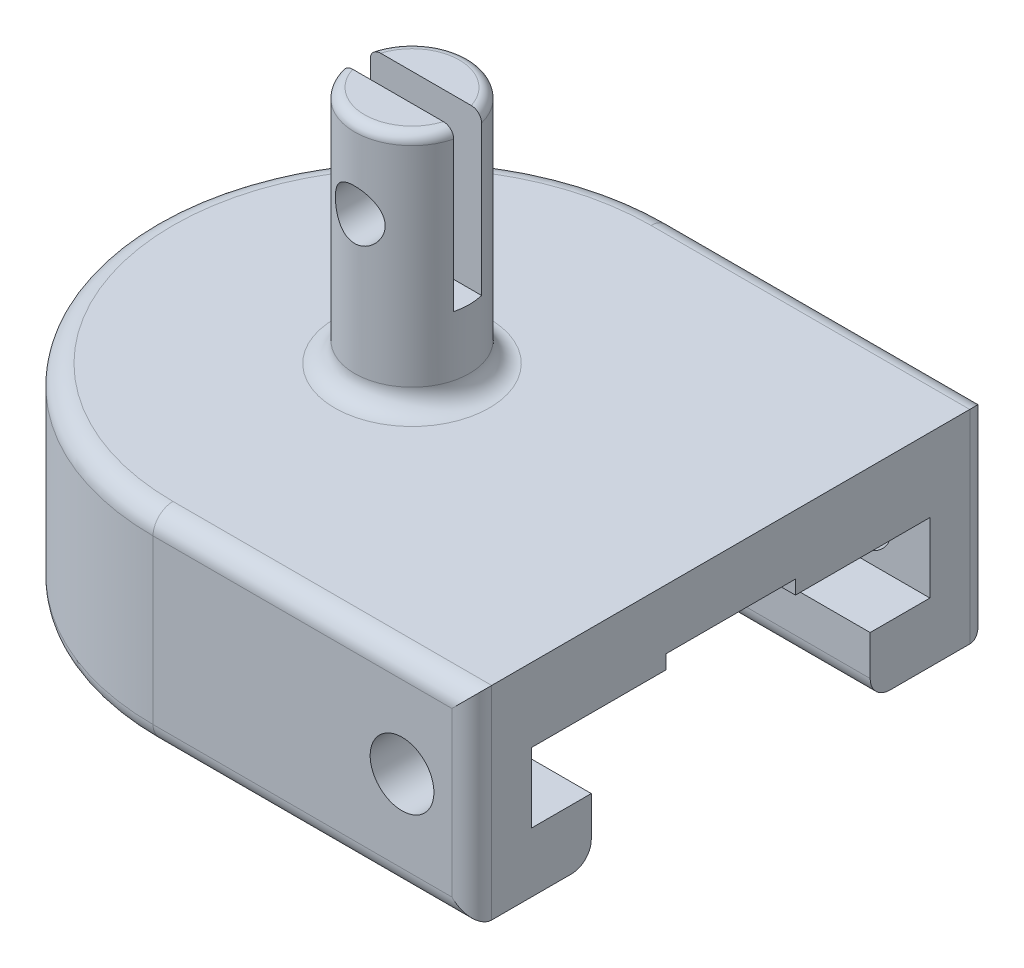
from build123d import *

# Parameters (mm, degrees)
BOSS_EXTRUDE1_DEPTH   = 3
BOSS_EXTRUDE2_DEPTH   = 3.5
BOSS_EXTRUDE3_DEPTH   = 3.7
SKETCH4_R             = 2.88
BOSS_EXTRUDE4_DEPTH   = 12
SKETCH11_W            = 6.5
SKETCH11_H            = 0.7
CUT_EXTRUDE3_DEPTH    = 23
F_2_5MM_DOWEL_HOLE1_D = 2.5
SKETCH8_R             = 1.6
CUT_EXTRUDE1_DEPTH    = 38.747052924
FILLET1_R             = 1
FILLET2_R             = 1
CUT_EXTRUDE2_START    = -8
CUT_EXTRUDE2_DEPTH    = 8
FILLET3_R             = 0.5


with BuildPart() as part:
    # Sketch1 → Boss-Extrude1 (new body)
    with BuildSketch(Plane(origin=(0, 0, 0), x_dir=(1, 0, 0), z_dir=(0, 1, 0))):
        with BuildLine():
            Line((0, 13), (16, 13))
            Line((16, 13), (16, 7))
            Line((16, 7), (0, 7))
            ThreePointArc((0, 7), (-7, 0), (0, -7))
            Line((0, -7), (16, -7))
            Line((16, -7), (16, -13))
            Line((16, -13), (0, -13))
            ThreePointArc((0, -13), (-13, 0), (0, 13))
        make_face()
    extrude(amount=BOSS_EXTRUDE1_DEPTH)

    # Sketch2 → Boss-Extrude2 (add)
    with BuildSketch(Plane(origin=(0, 3, 0), x_dir=(1, 0, 0), z_dir=(0, 1, 0))):
        with BuildLine():
            Line((0, 13), (16, 13))
            Line((16, 13), (16, 10))
            Line((16, 10), (0, 10))
            ThreePointArc((0, 10), (-10, 0), (0, -10))
            Line((0, -10), (16, -10))
            Line((16, -10), (16, -13))
            Line((16, -13), (0, -13))
            ThreePointArc((0, -13), (-13, 0), (0, 13))
        make_face()
    extrude(amount=BOSS_EXTRUDE2_DEPTH)

    # Sketch3 → Boss-Extrude3 (add)
    with BuildSketch(Plane(origin=(0, 6.5, 0), x_dir=(1, 0, 0), z_dir=(0, 1, 0))):
        with BuildLine():
            Line((16, 13), (0, 13))
            ThreePointArc((0, 13), (-13, 0), (0, -13))
            Line((0, -13), (16, -13))
            Line((16, -13), (16, -7))
            Line((16, -7), (16, 7))
            Line((16, 7), (16, 13))
        make_face()
    extrude(amount=BOSS_EXTRUDE3_DEPTH)

    # Sketch4 → Boss-Extrude4 (add)
    with BuildSketch(Plane(origin=(0, 10.2, 0), x_dir=(1, 0, 0), z_dir=(0, 1, 0))):
        Circle(SKETCH4_R)
    extrude(amount=BOSS_EXTRUDE4_DEPTH)

    # Sketch11 → Cut-Extrude3 (cut)
    with BuildSketch(Plane(origin=(16, 0, 0), x_dir=(0, 0, -1), z_dir=(1, 0, 0))):
        with Locations((0, 6.85)):
            Rectangle(SKETCH11_W, SKETCH11_H)
    extrude(amount=-CUT_EXTRUDE3_DEPTH, mode=Mode.SUBTRACT)

    # Ø2.5mm Dowel Hole1 (through all)
    with Locations(Plane(origin=(-0.002429038, 18.104937254, 2.879998976), x_dir=(0.999999644325, 0, 0.000843415861), z_dir=(-0.000843415861, 0, 0.999999644325))):
        with Locations((0, 0)):
            Hole(F_2_5MM_DOWEL_HOLE1_D / 2)

    # Sketch8 → Cut-Extrude1 (cut, through all)
    with BuildSketch(Plane.XY.offset(13)):
        with Locations((12.5, 5.1)):
            Circle(SKETCH8_R)
    extrude(amount=-CUT_EXTRUDE1_DEPTH, mode=Mode.SUBTRACT)

    # Fillet1
    fillet1_edges = [part.edges().sort_by_distance(p)[0] for p in [
        (8, 10.2, -13),
        (-13, 10.2, 0),
        (8, 0, -13),
        (-13, 0, 0),
        (8, 10.2, 13),
        (16, 5.1, 13),
        (8, 0, 13),
        (8, 0, -7),
        (-7, 0, 0),
        (8, 0, 7),
        (16, 5.1, -13),
    ]]
    fillet(fillet1_edges, radius=FILLET1_R)

    # Fillet2
    fillet2_edges = [part.edges().sort_by_distance(p)[0] for p in [
        (-2.88, 10.2, 0),
    ]]
    fillet(fillet2_edges, radius=FILLET2_R)

    # Sketch10 → Cut-Extrude2 (cut)
    with BuildSketch(Plane(origin=(0, 22.2, 0), x_dir=(1, 0, 0), z_dir=(0, 1, 0)).offset(CUT_EXTRUDE2_START)):
        with BuildLine():
            Line((-2.793635624, 0.7), (2.793635624, 0.7))
            ThreePointArc((2.793635624, 0.7), (2.88, 0), (2.793635624, -0.7))
            Line((2.793635624, -0.7), (-2.793635624, -0.7))
            ThreePointArc((-2.793635624, -0.7), (-2.88, 0), (-2.793635624, 0.7))
        make_face()
    extrude(amount=CUT_EXTRUDE2_DEPTH, mode=Mode.SUBTRACT)

    # Fillet3
    fillet3_edges = [part.edges().sort_by_distance(p)[0] for p in [
        (0, 22.2, -2.88),
        (0, 22.2, 2.88),
    ]]
    fillet(fillet3_edges, radius=FILLET3_R)


solid = part.part
